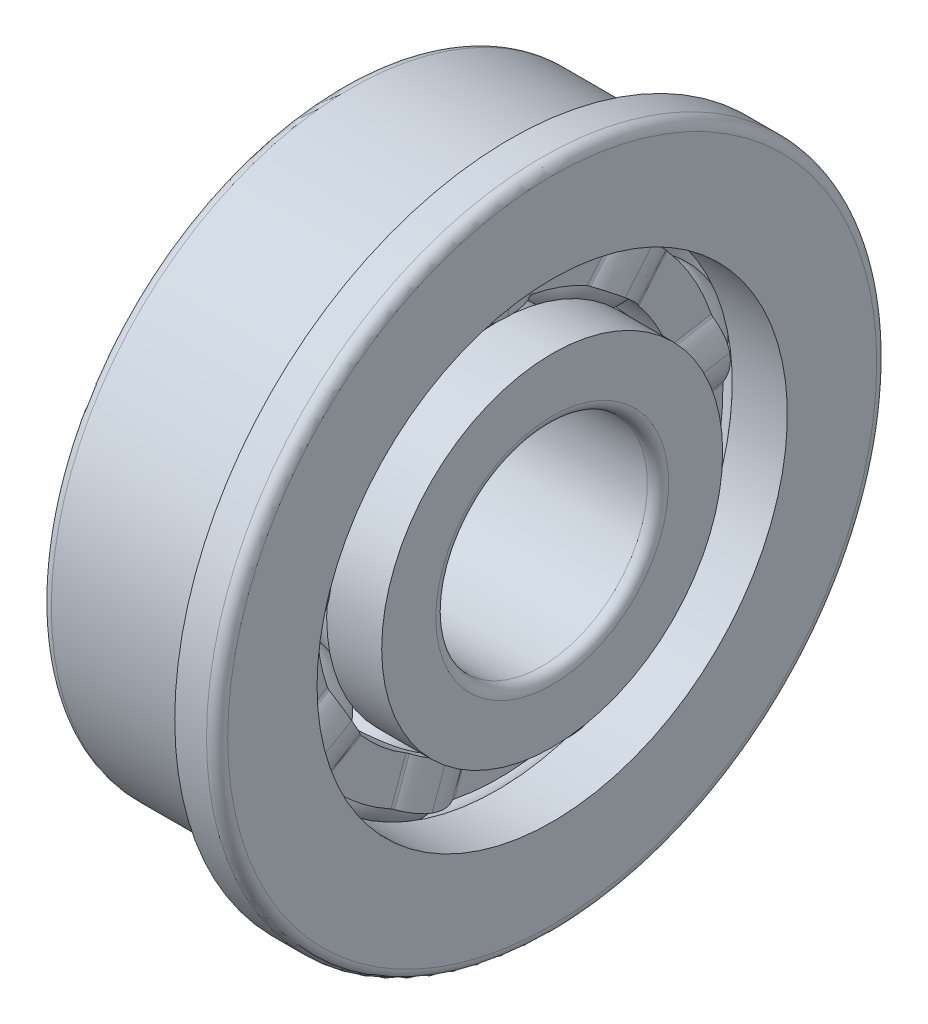
from build123d import *

# Parameters (mm, degrees)
SKETCH10_W                = 3.536157276
SKETCH10_H                = 1.222222222
PATTERN_BALL_COUNT        = 9
COSMETIC_FILLET_OUTER_1_R = 0.3
COSMETIC_FILLET_OUTER_2_R = 0.3
COSMETIC_FILLET_INNER_1_R = 0.3
COSMETIC_FILLET_INNER_2_R = 0.3


with BuildPart() as part:
    # Sketch7 → Body-Ball (revolve)
    with BuildSketch(Plane.XY):
        with BuildLine():
            Line((-1.65, 5.75), (1.65, 5.75))
            ThreePointArc((1.65, 5.75), (0, 4.1), (-1.65, 5.75))
        make_face()
    body_ball = revolve(axis=Axis((-1.65, 5.75, 0), (1, 0, 0)))

    # Sketch10 → Body-Ball-Cage (revolve)
    with BuildSketch(Plane.XY, mode=Mode.PRIVATE) as body_ball_cage_sk:
        with Locations((0, 5.75)):
            Rectangle(SKETCH10_W, SKETCH10_H)
    revolve(body_ball_cage_sk.sketch.rotate(Axis((-3, 0, 0), (1, 0, 0)), 90), axis=Axis((-3, 0, 0), (1, 0, 0)))

    # Sketch16 for Cut-Ball-Cag → Cut-Ball-Cage-1 section 0
    with BuildSketch(Plane(origin=(0, 3.516125048, 1.279764857), x_dir=(-1, 0, 0), z_dir=(-3.4914813388431337e-15, 0.9396926207859081, 0.3420201433256697))):
        with BuildLine():
            Line((1.478665118, -0.342669764), (1.478665118, 0.342669764))
            # circular arc as an exact rational Bezier (weights 1, cos(half-angle), 1)
            Bezier((1.478665118, 0.342669764), (1.478665118, 0.391320952), (1.504232966, 0.432712053), weights=[1, 0.961970026, 1])
            Bezier((1.504232966, 0.432712053), (1.768078638, 0.859844696), (1.768078638, 1.361897315), weights=[1, 0.961970026, 1])
            Line((1.768078638, 1.361897315), (1.768078638, -1.361897315))
            Bezier((1.768078638, -1.361897315), (1.768078638, -0.859844696), (1.504232966, -0.432712053), weights=[1, 0.961970026, 1])
            Bezier((1.504232966, -0.432712053), (1.478665118, -0.391320952), (1.478665118, -0.342669764), weights=[1, 0.961970026, 1])
        make_face()
    # Sketch17 for Cut-Ball-Cag → Cut-Ball-Cage-1 section 1
    with BuildSketch(Plane(origin=(0, 6.6386305, 2.416263898), x_dir=(1, 0, 0), z_dir=(-3.4914813388431334e-15, -0.939692620785908, -0.34202014332566977))):
        with BuildLine():
            Line((-1.478665118, -1.552106782), (-1.478665118, 1.552106782))
            Bezier((-1.478665118, 1.552106782), (-1.478665118, 1.60075797), (-1.504232966, 1.642149071), weights=[1, 0.961970026, 1])
            Bezier((-1.504232966, 1.642149071), (-1.768078638, 2.069281714), (-1.768078638, 2.571334333), weights=[1, 0.961970026, 1])
            Line((-1.768078638, 2.571334333), (-1.768078638, -2.571334333))
            Bezier((-1.768078638, -2.571334333), (-1.768078638, -2.069281714), (-1.504232966, -1.642149071), weights=[1, 0.961970026, 1])
            Bezier((-1.504232966, -1.642149071), (-1.478665118, -1.60075797), (-1.478665118, -1.552106782), weights=[1, 0.961970026, 1])
        make_face()
    cut_ball_cage_1 = loft(mode=Mode.SUBTRACT)

    # Sketch15 for Cut-Ball-Cag → Cut-Ball-Cage-2 section 0
    with BuildSketch(Plane(origin=(0, 6.6386305, 2.416263898), x_dir=(1, 0, 0), z_dir=(-3.4914813388431334e-15, -0.939692620785908, -0.34202014332566977))):
        with BuildLine():
            Line((1.478665118, -1.552106782), (1.478665118, 1.552106782))
            Bezier((1.478665118, 1.552106782), (1.478665118, 1.60075797), (1.504232966, 1.642149071), weights=[1, 0.961970026, 1])
            Bezier((1.504232966, 1.642149071), (1.768078638, 2.069281714), (1.768078638, 2.571334333), weights=[1, 0.961970026, 1])
            Line((1.768078638, 2.571334333), (1.768078638, -2.571334333))
            Bezier((1.768078638, -2.571334333), (1.768078638, -2.069281714), (1.504232966, -1.642149071), weights=[1, 0.961970026, 1])
            Bezier((1.504232966, -1.642149071), (1.478665118, -1.60075797), (1.478665118, -1.552106782), weights=[1, 0.961970026, 1])
        make_face()
    # Sketch14 for Cut-Ball-Cag → Cut-Ball-Cage-2 section 1
    with BuildSketch(Plane(origin=(0, 3.516125048, 1.279764857), x_dir=(-1, 0, 0), z_dir=(-3.4914813388431337e-15, 0.9396926207859081, 0.3420201433256697))):
        with BuildLine():
            Line((-1.478665118, -0.342669764), (-1.478665118, 0.342669764))
            Bezier((-1.478665118, 0.342669764), (-1.478665118, 0.391320952), (-1.504232966, 0.432712053), weights=[1, 0.961970026, 1])
            Bezier((-1.504232966, 0.432712053), (-1.768078638, 0.859844696), (-1.768078638, 1.361897315), weights=[1, 0.961970026, 1])
            Line((-1.768078638, 1.361897315), (-1.768078638, -1.361897315))
            Bezier((-1.768078638, -1.361897315), (-1.768078638, -0.859844696), (-1.504232966, -0.432712053), weights=[1, 0.961970026, 1])
            Bezier((-1.504232966, -0.432712053), (-1.478665118, -0.391320952), (-1.478665118, -0.342669764), weights=[1, 0.961970026, 1])
        make_face()
    cut_ball_cage_2 = loft(mode=Mode.SUBTRACT)

    # Pattern-Ball: Body-Ball, Cut-Ball-Cage-1, Cut-Ball-Cage-2 ×9 about axis
    pattern_ball_axis = Axis((-1.1, 0, 0), (1, 0, 0))
    add([body_ball.rotate(pattern_ball_axis, i * 360 / PATTERN_BALL_COUNT) for i in range(1, PATTERN_BALL_COUNT)])
    add([cut_ball_cage_1.rotate(pattern_ball_axis, i * 360 / PATTERN_BALL_COUNT) for i in range(1, PATTERN_BALL_COUNT)], mode=Mode.SUBTRACT)
    add([cut_ball_cage_2.rotate(pattern_ball_axis, i * 360 / PATTERN_BALL_COUNT) for i in range(1, PATTERN_BALL_COUNT)], mode=Mode.SUBTRACT)

    # Sketch2 → Body-Inner (revolve)
    with BuildSketch(Plane.XY, mode=Mode.PRIVATE) as body_inner_sk:
        with BuildLine():
            Line((-3, 4.833333333), (-3, 3))
            Line((-3, 3), (3, 3))
            Line((3, 3), (3, 4.833333333))
            Line((3, 4.833333333), (1.439281178, 4.833333333))
            ThreePointArc((1.439281178, 4.833333333), (0, 4.167340136), (-1.439281178, 4.833333333))
            Line((-1.439281178, 4.833333333), (-3, 4.833333333))
        make_face()
    revolve(body_inner_sk.sketch.rotate(Axis((-3, 0, 0), (1, 0, 0)), 89.782585438), axis=Axis((-3, 0, 0), (1, 0, 0)))

    # Sketch8 → Body-Outer (revolve)
    with BuildSketch(Plane.XY, mode=Mode.PRIVATE) as body_outer_sk:
        with BuildLine():
            Line((1.8, 9.5), (1.8, 8.5))
            Line((1.8, 8.5), (-3, 8.5))
            Line((-3, 8.5), (-3, 6.666666667))
            Line((-3, 6.666666667), (-1.439281178, 6.666666667))
            ThreePointArc((-1.439281178, 6.666666667), (0, 7.332659864), (1.439281178, 6.666666667))
            Line((1.439281178, 6.666666667), (3, 6.666666667))
            Line((3, 6.666666667), (3, 9.5))
            Line((3, 9.5), (1.8, 9.5))
        make_face()
    revolve(body_outer_sk.sketch.rotate(Axis((-3, 0, 0), (1, 0, 0)), 90), axis=Axis((-3, 0, 0), (1, 0, 0)))

    # Cosmetic-Fillet-Outer-1
    cosmetic_fillet_outer_1_edges = [part.edges().sort_by_distance(p)[0] for p in [
        (-3, 0, -8.5),
    ]]
    fillet(cosmetic_fillet_outer_1_edges, radius=COSMETIC_FILLET_OUTER_1_R)

    # Cosmetic-Fillet-Outer-2
    cosmetic_fillet_outer_2_edges = [part.edges().sort_by_distance(p)[0] for p in [
        (3, 0, -9.5),
    ]]
    fillet(cosmetic_fillet_outer_2_edges, radius=COSMETIC_FILLET_OUTER_2_R)

    # Cosmetic-Fillet-Inner-1
    cosmetic_fillet_inner_1_edges = [part.edges().sort_by_distance(p)[0] for p in [
        (-3, -0.011383773, -2.999978402),
    ]]
    fillet(cosmetic_fillet_inner_1_edges, radius=COSMETIC_FILLET_INNER_1_R)

    # Cosmetic-Fillet-Inner-2
    cosmetic_fillet_inner_2_edges = [part.edges().sort_by_distance(p)[0] for p in [
        (3, -0.011383773, -2.999978402),
    ]]
    fillet(cosmetic_fillet_inner_2_edges, radius=COSMETIC_FILLET_INNER_2_R)


solid = part.part
